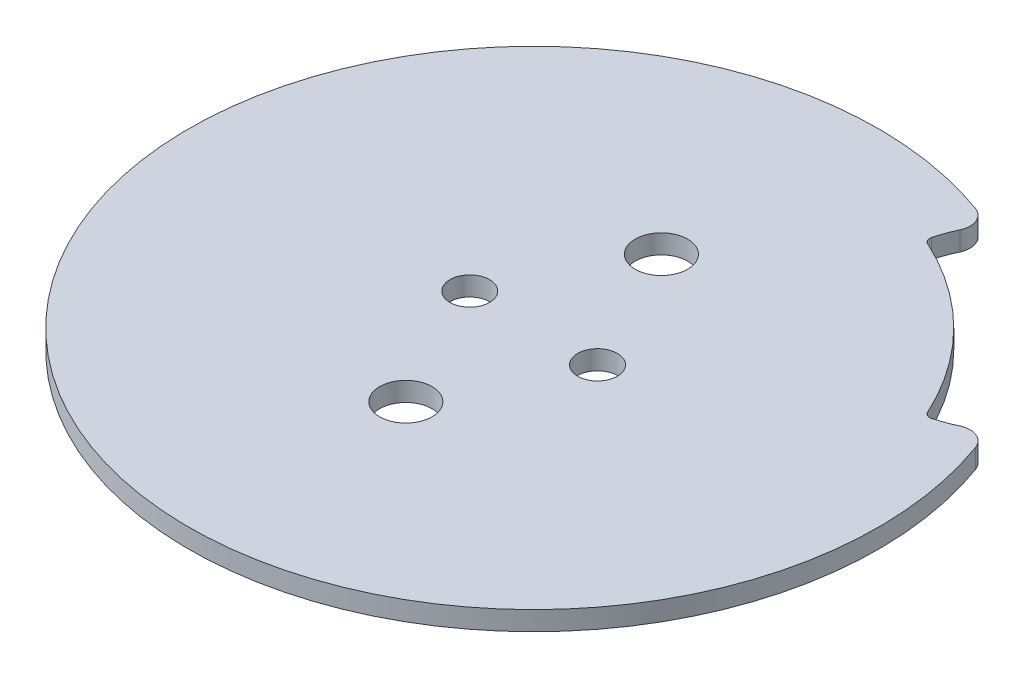
from build123d import *

# Parameters (mm, degrees)
SKETCH1_R           = 3.1
SKETCH1_R_2         = 4.1
BOSS_EXTRUDE1_DEPTH = 3
FILLET1_R           = 3
FILLET2_R           = 1


with BuildPart() as part:
    # Sketch1 → Boss-Extrude1 (new body)
    with BuildSketch(Plane(origin=(0, 0, 0), x_dir=(1, 0, 0), z_dir=(0, 1, 0))):
        with BuildLine():
            ThreePointArc((21.667324002, 49.462380357), (-38.183766184, -38.183766184), (49.462380357, 21.667324002))
            ThreePointArc((49.462380357, 21.667324002), (46.165505457, 19.845504593), (42.585510083, 18.674162122))
            ThreePointArc((42.585510083, 18.674162122), (32.880465325, 32.880465325), (18.674162122, 42.585510083))
            ThreePointArc((18.674162122, 42.585510083), (19.845504593, 46.165505457), (21.667324002, 49.462380357))
        make_face()
        with Locations((10, 0)):
            Circle(SKETCH1_R, mode=Mode.SUBTRACT)
        with Locations((0, 20)):
            Circle(SKETCH1_R_2, mode=Mode.SUBTRACT)
        with Locations((0, -20)):
            Circle(SKETCH1_R_2, mode=Mode.SUBTRACT)
        with Locations((-10, 0)):
            Circle(SKETCH1_R, mode=Mode.SUBTRACT)
    extrude(amount=BOSS_EXTRUDE1_DEPTH)

    # Fillet1
    fillet1_edges = [part.edges().sort_by_distance(p)[0] for p in [
        (49.462380357, 1.5, -21.667324002),
        (21.667324002, 1.5, -49.462380357),
    ]]
    fillet(fillet1_edges, radius=FILLET1_R)

    # Fillet2
    fillet2_edges = [part.edges().sort_by_distance(p)[0] for p in [
        (42.585510083, 1.5, -18.674162122),
        (18.674162122, 1.5, -42.585510083),
    ]]
    fillet(fillet2_edges, radius=FILLET2_R)


solid = part.part
